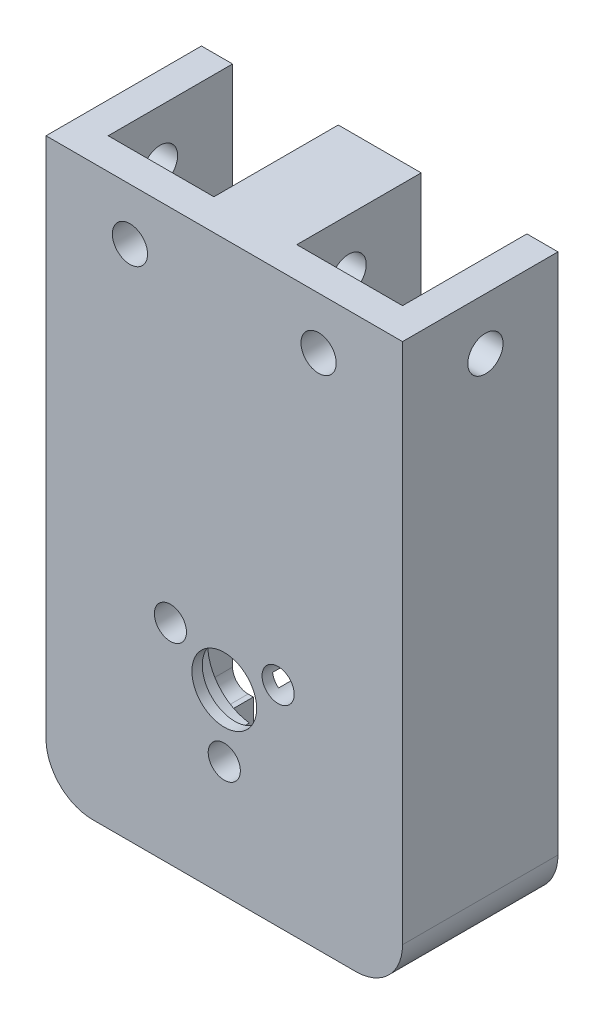
from build123d import *

# Parameters (mm, degrees)
MAIN_POCKETS_DEPTH   = 12
SKETCH2_W            = 34.4
SKETCH2_H            = 54.9
SKETCH2_R            = 1.55
SKETCH2_R_2          = 1.7
SKETCH2_R_3          = 3.125
MOUNTING_HOLES_DEPTH = 3
SKETCH3_R            = 4.6
CUT_EXTRUDE1_DEPTH   = 2
SKETCH4_R            = 1.5
CUT_EXTRUDE2_DEPTH   = 12
SKETCH5_R            = 1.75
CUT_EXTRUDE4_DEPTH   = 3
SKETCH6_W            = 24.4
SKETCH6_H            = 10
CUT_EXTRUDE6_DEPTH   = 3
SKETCH8_R            = 1.7
CUT_EXTRUDE7_DEPTH   = 53.427569083
FILLET1_R            = 1.5
FILLET2_R            = 4.5
FILLET3_R            = 3


with BuildPart() as part:
    # Sketch1 → Main Pockets (new body)
    with BuildSketch(Plane.XY):
        Polygon((17.2, 1.276454737), (17.2, 37.7), (14.2, 37.7), (14.2, 17.7), (4, 17.7), (4, 37.7), (-4, 37.7), (-4, 17.7), (-14.2, 17.7), (-14.2, 37.7), (-17.2, 37.7), (-17.2, 1.276454737), (-17.2, -17.2), (17.2, -17.2), align=None)
        Polygon((-14.2, -14.2), (14.2, -14.2), (14.2, 0), (14.2, 14.7), (4, 14.7), (4, 14.1), (-4, 14.1), (-4, 14.7), (-14.2, 14.7), (-14.2, 0), align=None, mode=Mode.SUBTRACT)
    extrude(amount=-MAIN_POCKETS_DEPTH)

    # Sketch2 → Mounting Holes (add)
    with BuildSketch(Plane.XY):
        with Locations((0, 10.25)):
            Rectangle(SKETCH2_W, SKETCH2_H)
        with Locations((0, -6)):
            Circle(SKETCH2_R, mode=Mode.SUBTRACT)
        with Locations((-5.196152423, 3)):
            Circle(SKETCH2_R, mode=Mode.SUBTRACT)
        with Locations((5.196152423, 3)):
            Circle(SKETCH2_R, mode=Mode.SUBTRACT)
        with Locations((-9.1, 32.7)):
            Circle(SKETCH2_R_2, mode=Mode.SUBTRACT)
        with Locations((9.1, 32.7)):
            Circle(SKETCH2_R_2, mode=Mode.SUBTRACT)
        Circle(SKETCH2_R_3, mode=Mode.SUBTRACT)
    extrude(amount=MOUNTING_HOLES_DEPTH)

    # Sketch3 → Cut-Extrude1 (cut)
    with BuildSketch(Plane.XY):
        Circle(SKETCH3_R)
    extrude(amount=CUT_EXTRUDE1_DEPTH, mode=Mode.SUBTRACT)

    # Sketch4 → Cut-Extrude2 (cut)
    with BuildSketch(Plane(origin=(0, 0, -12), x_dir=(-1, 0, 0), z_dir=(0, 0, -1))):
        with Locations((-14.2, 17.7)):
            Circle(SKETCH4_R)
        with Locations((-4, 17.7)):
            Circle(SKETCH4_R)
        with Locations((4, 17.7)):
            Circle(SKETCH4_R)
        with Locations((14.2, 17.7)):
            Circle(SKETCH4_R)
    extrude(amount=-CUT_EXTRUDE2_DEPTH, mode=Mode.SUBTRACT)

    # Sketch5 → Cut-Extrude4 (cut)
    with BuildSketch(Plane(origin=(0, 17.7, 0), x_dir=(1, 0, 0), z_dir=(0, 1, 0))):
        with Locations(Location((-9.1, 5, 0), (0, 0, 270))):
            Circle(SKETCH5_R)
        with Locations(Location((9.1, 5, 0), (0, 0, 270))):
            Circle(SKETCH5_R)
    extrude(amount=-CUT_EXTRUDE4_DEPTH, mode=Mode.SUBTRACT)

    # Sketch6 → Cut-Extrude6 (cut)
    with BuildSketch(Plane.XZ.offset(17.2)):
        with Locations((0, -7)):
            Rectangle(SKETCH6_W, SKETCH6_H)
    extrude(amount=-CUT_EXTRUDE6_DEPTH, mode=Mode.SUBTRACT)

    # Sketch8 → Cut-Extrude7 (cut, through all)
    with BuildSketch(Plane(origin=(17.2, 0, 0), x_dir=(0, 0, -1), z_dir=(1, 0, 0))):
        with Locations((5, 32.7)):
            Circle(SKETCH8_R)
    extrude(amount=-CUT_EXTRUDE7_DEPTH, mode=Mode.SUBTRACT)

    # Fillet1
    # the kernel refuses this fillet: 1.5 mm, written as the material it adds along each edge
    with BuildSketch(Plane(origin=(-4, 14.7, 3), x_dir=(0, -1, 0), z_dir=(0, 0, -1))) as fillet1_piece_1:
        with BuildLine():
            CenterArc((1.5, 1.2), FILLET1_R, 180, 53.130102354)
            Line((0, 1.2), (0, 0))
            Line((0, 0), (0.6, 0))
        make_face()
    extrude(amount=15)
    with BuildSketch(Plane(origin=(4, 14.7, 3), x_dir=(1, 0, 0), z_dir=(0, 0, -1))) as fillet1_piece_2:
        with BuildLine():
            CenterArc((1.2, 1.5), FILLET1_R, 216.869897646, 53.130102354)
            Line((0, 0.6), (0, 0))
            Line((0, 0), (1.2, 0))
        make_face()
    extrude(amount=15)
    with BuildSketch(Plane(origin=(-14.2, -14.2, 0), x_dir=(1, 0, 0), z_dir=(0, 0, -1))) as fillet1_piece_3:
        with BuildLine():
            CenterArc((FILLET1_R, -FILLET1_R), FILLET1_R, 90, 90)
            Line((0, -FILLET1_R), (0, 0))
            Line((0, 0), (FILLET1_R, 0))
        make_face()
    extrude(amount=12)
    with BuildSketch(Plane(origin=(-14.2, 14.7, 0), x_dir=(1, 0, 0), z_dir=(0, 0, -1)), Plane(origin=(14.2, 14.7, 0), x_dir=(0, -1, 0), z_dir=(0, 0, -1)), Plane(origin=(14.2, -14.2, 0), x_dir=(-1, 0, 0), z_dir=(0, 0, -1))) as fillet1_piece_4:
        with BuildLine():
            CenterArc((FILLET1_R, FILLET1_R), FILLET1_R, 180, 90)
            Line((0, FILLET1_R), (0, 0))
            Line((0, 0), (FILLET1_R, 0))
        make_face()
    extrude(amount=12)

    # Fillet2
    fillet2_edges = [part.edges().sort_by_distance(p)[0] for p in [
        (17.2, -17.2, -4.5),
        (-17.2, -17.2, -4.5),
    ]]
    fillet(fillet2_edges, radius=FILLET2_R)

    # Fillet3
    fillet3_edges = [part.edges().sort_by_distance(p)[0] for p in [
        (-12.2, -15.7, -2),
        (12.2, -15.7, -2),
    ]]
    fillet(fillet3_edges, radius=FILLET3_R)


solid = part.part
